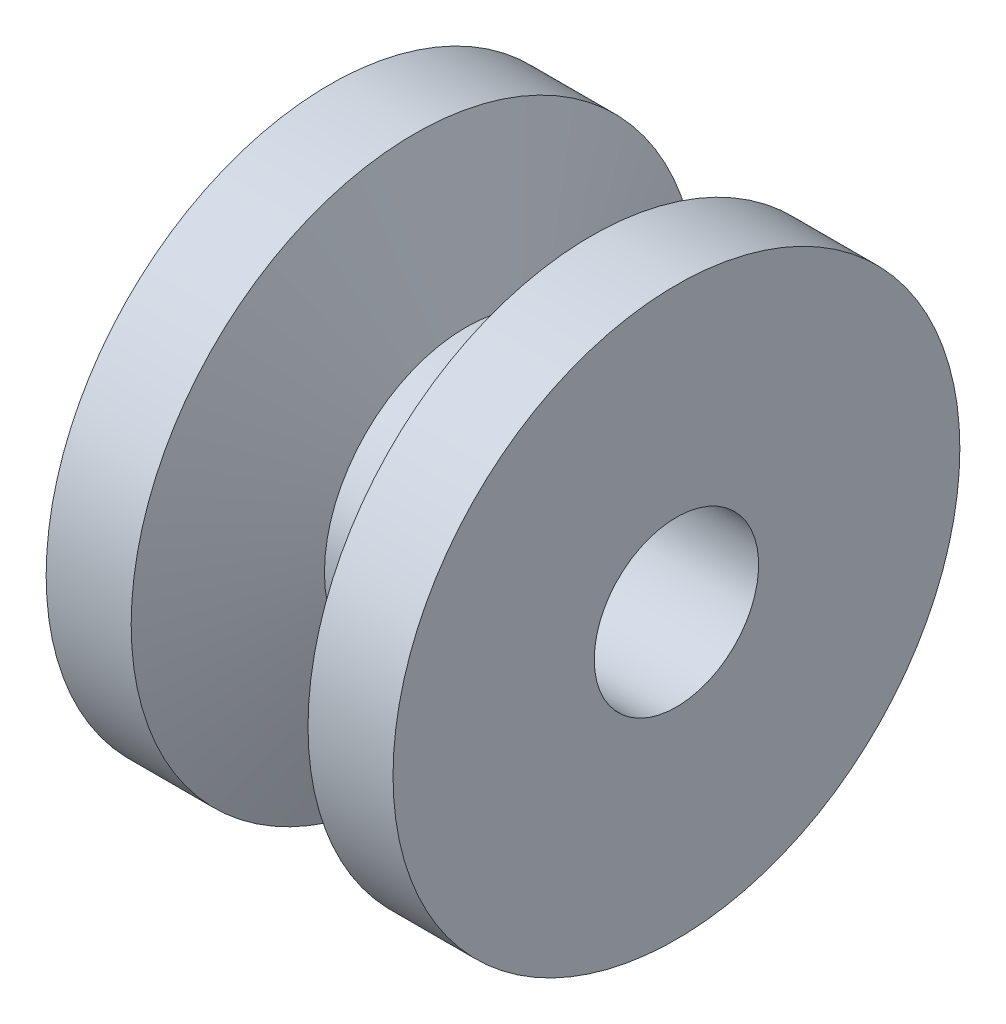
from build123d import *


with BuildPart() as part:
    # Sketch1 → Revolve1 (revolve)
    with BuildSketch(Plane(origin=(0, 0, 0), x_dir=(1, 0, 0), z_dir=(0, 1, 0))):
        Polygon((0, 12.7), (3.81, 12.7), (6.121210988, 6.35), (9.423210988, 6.35), (11.734421975, 12.7), (15.544421975, 12.7), (15.544421975, 3.683), (0, 3.683), align=None)
    revolve(axis=Axis((0, 0, 0), (1, 0, 0)))


solid = part.part
